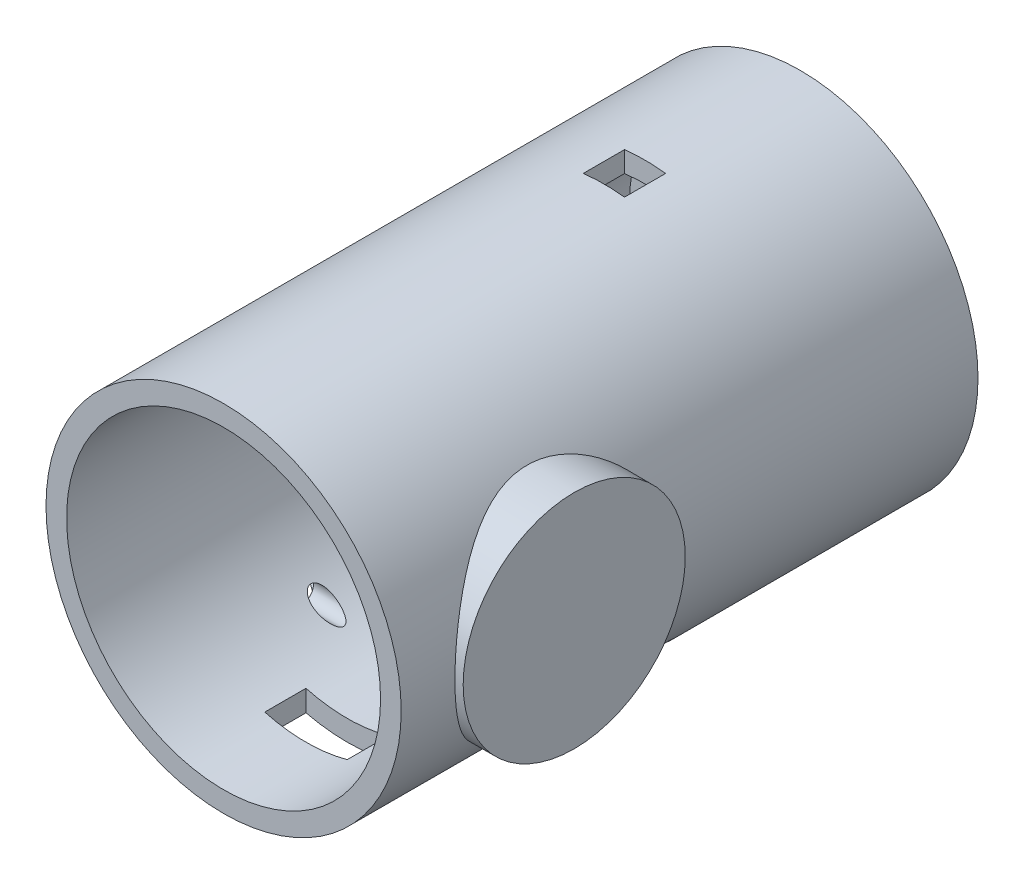
from build123d import *

# Parameters (mm, degrees)
SKETCH1_R               = 43.1
BOSS_EXTRUDE1_DEPTH     = 140
SKETCH6_W               = 10
SKETCH6_H               = 10
CUT_EXTRUDE3_DEPTH      = 170.964849307
SKETCH8_R               = 26.95
BOSS_EXTRUDE2_DEPTH     = 20
SKETCH5_R               = 31.75
CUT_EXTRUDE4_DEPTH      = 154.269762333
SKETCH2_R               = 38.1
CUT_EXTRUDE5_DEPTH      = 135
BOSS_EXTRUDE3_START     = 10
SKETCH9_R               = 38.1
SKETCH9_R_2             = 36.44
BOSS_EXTRUDE3_DEPTH     = 10
SKETCH10_W              = 20
SKETCH10_H              = 10
CUT_EXTRUDE6_DEPTH      = 154.269762333
CUT_EXTRUDE7_DEPTH      = 154.269762333
CUT_EXTRUDE7_DEPTH_BACK = 154.269762333
SKETCH11_R              = 2.5
SKETCH12_R              = 3.5
CUT_EXTRUDE8_DEPTH      = 162.964255472
CUT_EXTRUDE9_DEPTH      = 163.827577673


with BuildPart() as part:
    # Sketch1 → Boss-Extrude1 (new body)
    with BuildSketch(Plane.XY):
        Circle(SKETCH1_R)
    extrude(amount=BOSS_EXTRUDE1_DEPTH)

    # Sketch6 → Cut-Extrude3 (cut, through all)
    with BuildSketch(Plane(origin=(0, 43.1, 0), x_dir=(1, 0, 0), z_dir=(0, 1, 0))):
        with Locations((0, -42.7)):
            Rectangle(SKETCH6_W, SKETCH6_H)
    extrude(amount=-CUT_EXTRUDE3_DEPTH, mode=Mode.SUBTRACT)

    # Sketch8 → Boss-Extrude2 (add)
    with BuildSketch(Plane(origin=(45.1, 0, 0), x_dir=(0, 0, -1), z_dir=(1, 0, 0))):
        with Locations((-100, 0)):
            Circle(SKETCH8_R)
    extrude(amount=-BOSS_EXTRUDE2_DEPTH)

    # Sketch5 → Cut-Extrude4 (cut, through all)
    with BuildSketch(Plane.XY.offset(140)):
        Circle(SKETCH5_R)
    extrude(amount=-CUT_EXTRUDE4_DEPTH, mode=Mode.SUBTRACT)

    # Sketch2 → Cut-Extrude5 (cut)
    with BuildSketch(Plane.XY.offset(140)):
        Circle(SKETCH2_R)
    extrude(amount=-CUT_EXTRUDE5_DEPTH, mode=Mode.SUBTRACT)

    # Sketch9 → Boss-Extrude3 (add)
    with BuildSketch(Plane.XY.offset(5).offset(BOSS_EXTRUDE3_START)):
        Circle(SKETCH9_R)
        Circle(SKETCH9_R_2, mode=Mode.SUBTRACT)
    extrude(amount=-BOSS_EXTRUDE3_DEPTH)

    # Sketch10 → Cut-Extrude6 (cut, through all)
    with BuildSketch(Plane(origin=(0, 0, 0), x_dir=(1, 0, 0), z_dir=(0, 1, 0))):
        with Locations((0, -115)):
            Rectangle(SKETCH10_W, SKETCH10_H)
    extrude(amount=-CUT_EXTRUDE6_DEPTH, mode=Mode.SUBTRACT)

    # Sketch11 → Cut-Extrude7 (cut, two sides: drawn at the far end of the back side and taken through both)
    with BuildSketch(Plane(origin=(0, 0, 0), x_dir=(0, 0, -1), z_dir=(1, 0, 0)).offset(-CUT_EXTRUDE7_DEPTH_BACK)):
        with Locations((-64.7, -32)):
            Circle(SKETCH11_R)
        with Locations((-94.7, -32)):
            Circle(SKETCH11_R)
    extrude(amount=CUT_EXTRUDE7_DEPTH + CUT_EXTRUDE7_DEPTH_BACK, mode=Mode.SUBTRACT)

    # Sketch12 → Cut-Extrude8 (cut, through all)
    with BuildSketch(Plane(origin=(26, 0, 0), x_dir=(0, 0, -1), z_dir=(1, 0, 0))):
        with Locations((-64.7, -32)):
            Circle(SKETCH12_R)
        with Locations((-94.7, -32)):
            Circle(SKETCH12_R)
    extrude(amount=CUT_EXTRUDE8_DEPTH, mode=Mode.SUBTRACT)

    # Sketch13 → Cut-Extrude9 (cut, through all)
    with BuildSketch(Plane(origin=(-26, 0, 0), x_dir=(0, 0, -1), z_dir=(1, 0, 0))):
        Polygon((-92.679274058, -28.5), (-96.720725942, -28.5), (-98.741451884, -32), (-96.720725942, -35.5), (-92.679274058, -35.5), (-90.658548116, -32), align=None)
        Polygon((-62.679274058, -28.5), (-60.658548116, -32), (-62.679274058, -35.5), (-66.720725942, -35.5), (-68.741451884, -32), (-66.720725942, -28.5), align=None)
    extrude(amount=-CUT_EXTRUDE9_DEPTH, mode=Mode.SUBTRACT)


solid = part.part
